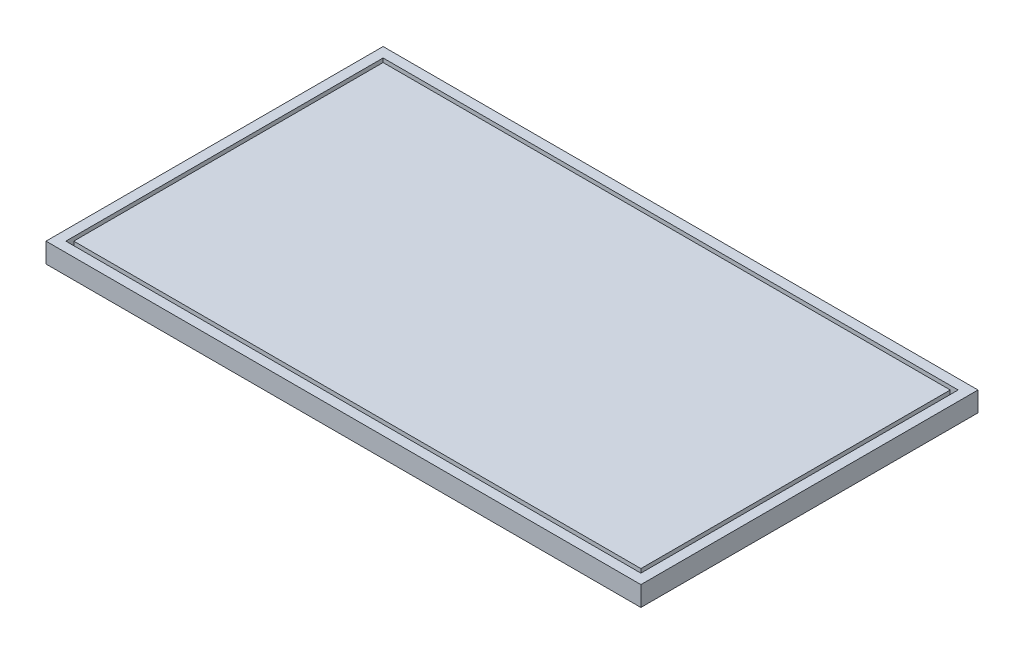
from build123d import *

# Parameters (mm, degrees)
SKETCH1_W           = 300
SKETCH1_H           = 170
BOSS_EXTRUDE1_DEPTH = 10
SKETCH2_W           = 290
SKETCH2_H           = 160
SKETCH2_W_2         = 286
SKETCH2_H_2         = 156
CUT_EXTRUDE1_DEPTH  = 5


with BuildPart() as part:
    # Sketch1 → Boss-Extrude1 (new body)
    with BuildSketch(Plane(origin=(0, 0, 0), x_dir=(1, 0, 0), z_dir=(0, 1, 0))):
        with Locations((-10.575275385, -12.987279515)):
            Rectangle(SKETCH1_W, SKETCH1_H)
    extrude(amount=BOSS_EXTRUDE1_DEPTH)

    # Sketch2 → Cut-Extrude1 (cut)
    with BuildSketch(Plane(origin=(0, 10, 0), x_dir=(1, 0, 0), z_dir=(0, 1, 0))):
        with Locations((-10.575275385, -12.987279515)):
            Rectangle(SKETCH2_W, SKETCH2_H)
        with Locations((-10.575275385, -12.987279515)):
            Rectangle(SKETCH2_W_2, SKETCH2_H_2, mode=Mode.SUBTRACT)
    extrude(amount=-CUT_EXTRUDE1_DEPTH, mode=Mode.SUBTRACT)


solid = part.part
